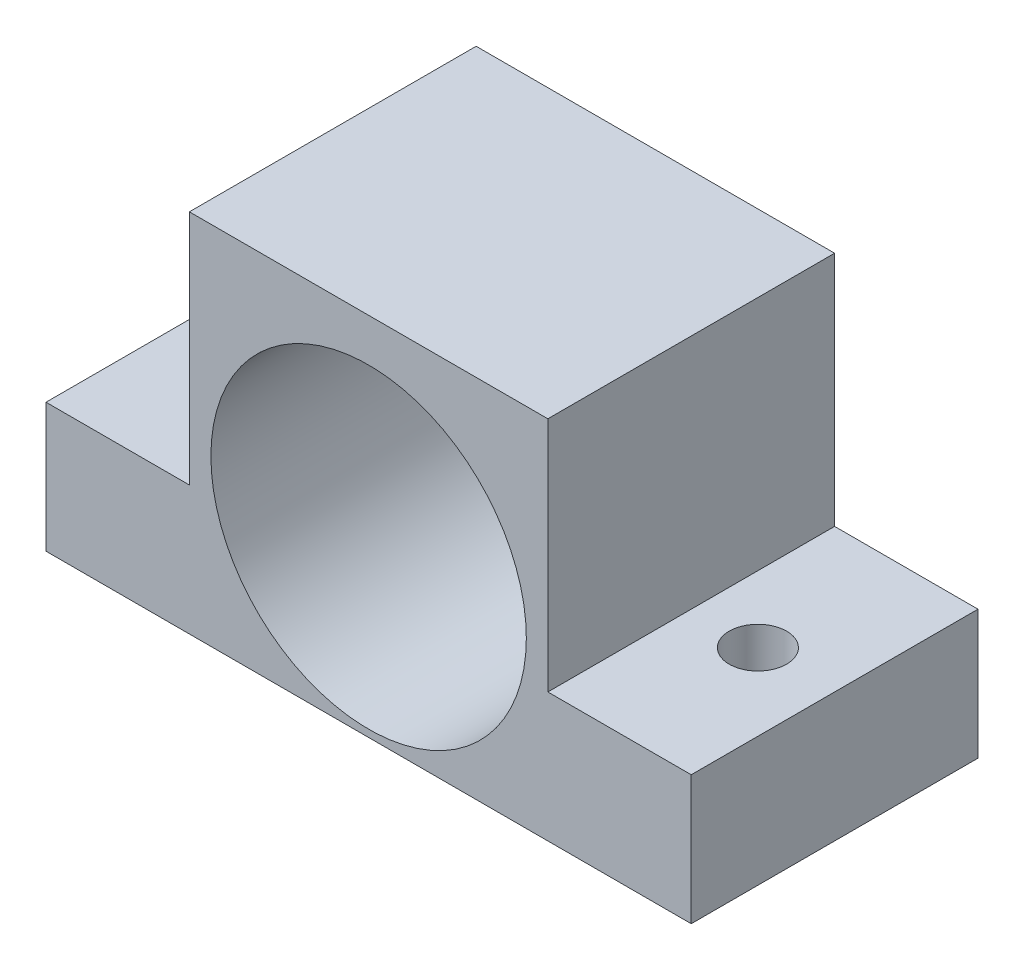
from build123d import *

# Parameters (mm, degrees)
SKETCH1_R           = 11
BOSS_EXTRUDE1_DEPTH = 20
SKETCH2_R           = 2
CUT_EXTRUDE1_DEPTH  = 9


with BuildPart() as part:
    # Sketch1 → Boss-Extrude1 (new body)
    with BuildSketch(Plane.XY):
        Polygon((13.551746227, 8), (-11.448253773, 8), (-11.448253773, -8.5), (-21.448253773, -8.5), (-21.448253773, -17.5), (23.551746227, -17.5), (23.551746227, -8.5), (13.551746227, -8.5), align=None)
        with Locations((1.051746227, -6)):
            Circle(SKETCH1_R, mode=Mode.SUBTRACT)
    extrude(amount=BOSS_EXTRUDE1_DEPTH)

    # Sketch2 → Cut-Extrude1 (cut)
    with BuildSketch(Plane(origin=(0, -8.5, 0), x_dir=(1, 0, 0), z_dir=(0, 1, 0))):
        with Locations((-16.798835848, -10)):
            Circle(SKETCH2_R)
        with Locations((18.201164152, -10)):
            Circle(SKETCH2_R)
    extrude(amount=-CUT_EXTRUDE1_DEPTH, mode=Mode.SUBTRACT)


solid = part.part
